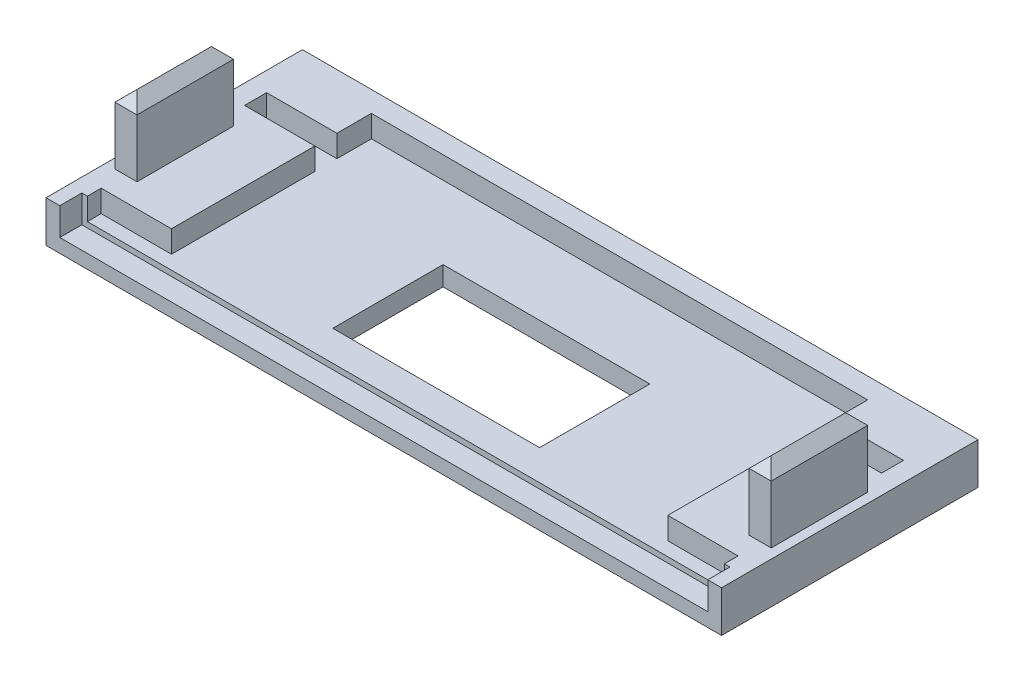
from build123d import *

# Parameters (mm, degrees)
ESQUISSE1_W                  = 49
ESQUISSE1_H                  = 3
BOSS_EXTRU_1_DEPTH           = 18.6
ENL_V_MAT_EXTRU_2_DEPTH      = 1.6
ENL_V_MAT_EXTRU_3_REACH      = 32.802
ESQUISSE6_W                  = 15
ESQUISSE6_H                  = 8
ESQUISSE7_W                  = 1.6
ESQUISSE7_H                  = 7
BOSS_EXTRU_2_DEPTH           = 5
CHANFREIN1_SIZE              = 0.8
CHANFREIN1_OF_SYM_TRIE1_SIZE = 0.8
ESQUISSE8_W                  = 47
ESQUISSE8_H                  = 2
ENL_V_MAT_EXTRU_4_DEPTH      = 1.6


with BuildPart() as part:
    # Esquisse1 → Boss.-Extru.1 (new body)
    with BuildSketch(Plane.XY):
        Rectangle(ESQUISSE1_W, ESQUISSE1_H)
    extrude(amount=BOSS_EXTRU_1_DEPTH)

    # Esquisse5 → Enlèv. mat.-Extru.2 (cut)
    with BuildSketch(Plane(origin=(0, 1.5, 0), x_dir=(1, 0, 0), z_dir=(0, 1, 0))):
        Polygon((-23.1, -4), (-23.1, -5.6), (-18, -5.6), (-18, -16), (-23.1, -16), (-23.1, -17.6), (23.1, -17.6), (23.1, -16), (18, -16), (18, -5.6), (23.1, -5.6), (23.1, -4), (18, -4), (18, -1.5), (-18, -1.5), (-18, -4), align=None)
    extrude(amount=-ENL_V_MAT_EXTRU_2_DEPTH, mode=Mode.SUBTRACT)

    # Esquisse6 → Enlèv. mat.-Extru.3 (cut, up to next)
    with BuildSketch(Plane(origin=(0, -0.1, 0), x_dir=(1, 0, 0), z_dir=(0, 1, 0)), mode=Mode.PRIVATE) as enl_v_mat_extru_3_sk1:
        with Locations((0, -10.8)):
            Rectangle(ESQUISSE6_W, ESQUISSE6_H)
    enl_v_mat_extru_3_tool1 = extrude(enl_v_mat_extru_3_sk1.sketch, amount=-ENL_V_MAT_EXTRU_3_REACH, mode=Mode.PRIVATE) & part.part
    add(enl_v_mat_extru_3_tool1.solids().sort_by_distance((0, -0.1, 10.8))[0], mode=Mode.SUBTRACT)

    # Esquisse7 → Boss.-Extru.2 (add)
    with BuildSketch(Plane(origin=(0, 1.5, 0), x_dir=(1, 0, 0), z_dir=(0, 1, 0))):
        with Locations((-23, -10.8)):
            Rectangle(ESQUISSE7_W, ESQUISSE7_H)
    boss_extru_2 = extrude(amount=BOSS_EXTRU_2_DEPTH)

    # Chanfrein1
    chanfrein1_edges = [part.edges().sort_by_distance(p)[0] for p in [
        (-22.2, 6.5, 10.8),
        (-23, 6.5, 7.3),
        (-23.8, 6.5, 10.8),
        (-23, 6.5, 14.3),
    ]]
    chamfer(chanfrein1_edges, length=CHANFREIN1_SIZE - 0.0001)  # a hair under: the kernel refuses the full size

    # Symétrie1: Boss.-Extru.2 across plane
    add(boss_extru_2.mirror(Plane(origin=(0, 0, 0), x_dir=(0, 0, 1), z_dir=(1, 0, 0))))

    # Chanfrein1 of Symétrie1
    chanfrein1_of_sym_trie1_edges = [part.edges().sort_by_distance(p)[0] for p in [
        (22.2, 6.5, 10.8),
        (23, 6.5, 7.3),
        (23.8, 6.5, 10.8),
        (23, 6.5, 14.3),
    ]]
    chamfer(chanfrein1_of_sym_trie1_edges, length=CHANFREIN1_OF_SYM_TRIE1_SIZE - 0.0001)  # a hair under: the kernel refuses the full size

    # Esquisse8 → Enlèv. mat.-Extru.4 (cut)
    with BuildSketch(Plane.XY.offset(18.6)):
        with Locations((0, 0.5)):
            Rectangle(ESQUISSE8_W, ESQUISSE8_H)
    extrude(amount=-ENL_V_MAT_EXTRU_4_DEPTH, mode=Mode.SUBTRACT)


solid = part.part
